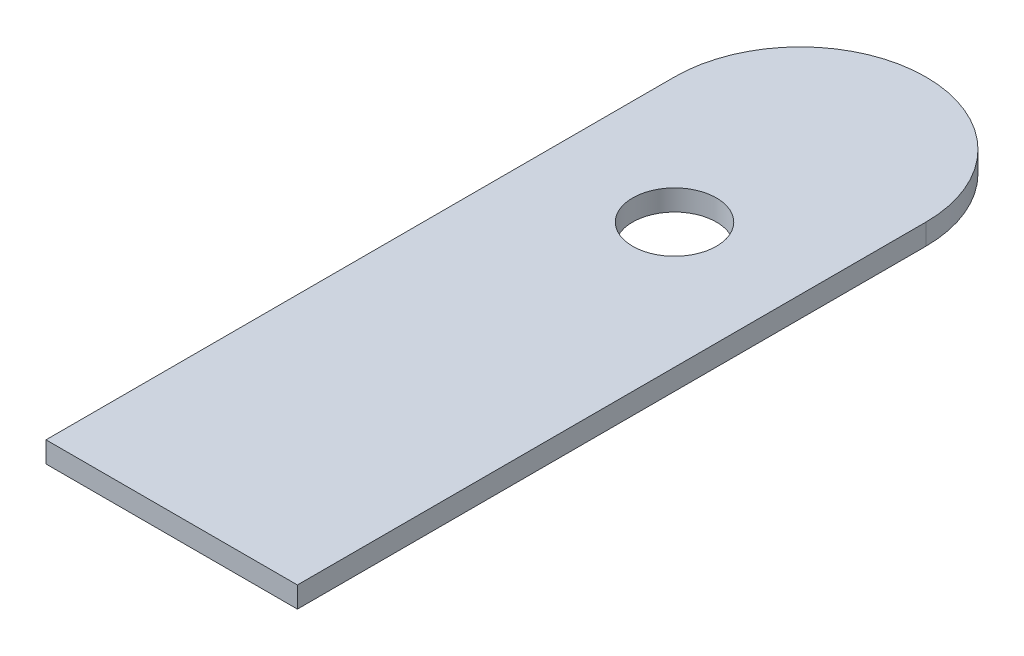
from build123d import *

# Parameters (mm, degrees)
SKETCH1_W           = 76.2
SKETCH1_H           = 228.6
SKETCH1_R           = 12.7
BOSS_EXTRUDE1_DEPTH = 6.35
FILLET1_R           = 38.1


with BuildPart() as part:
    # Sketch1 → Boss-Extrude1 (new body)
    with BuildSketch(Plane(origin=(0, 0, 0), x_dir=(-1, 0, 0), z_dir=(0, 1, 0))):
        Rectangle(SKETCH1_W, SKETCH1_H)
        with Locations(Location((0, -38.1, 0), (0, 0, 90))):
            Circle(SKETCH1_R, mode=Mode.SUBTRACT)
    extrude(amount=BOSS_EXTRUDE1_DEPTH)

    # Fillet1
    fillet1_edges = [part.edges().sort_by_distance(p)[0] for p in [
        (-38.1, 3.175, -114.3),
        (38.1, 3.175, -114.3),
    ]]
    fillet(fillet1_edges, radius=FILLET1_R - 0.0001)  # a hair under: the kernel refuses the full size


solid = part.part
